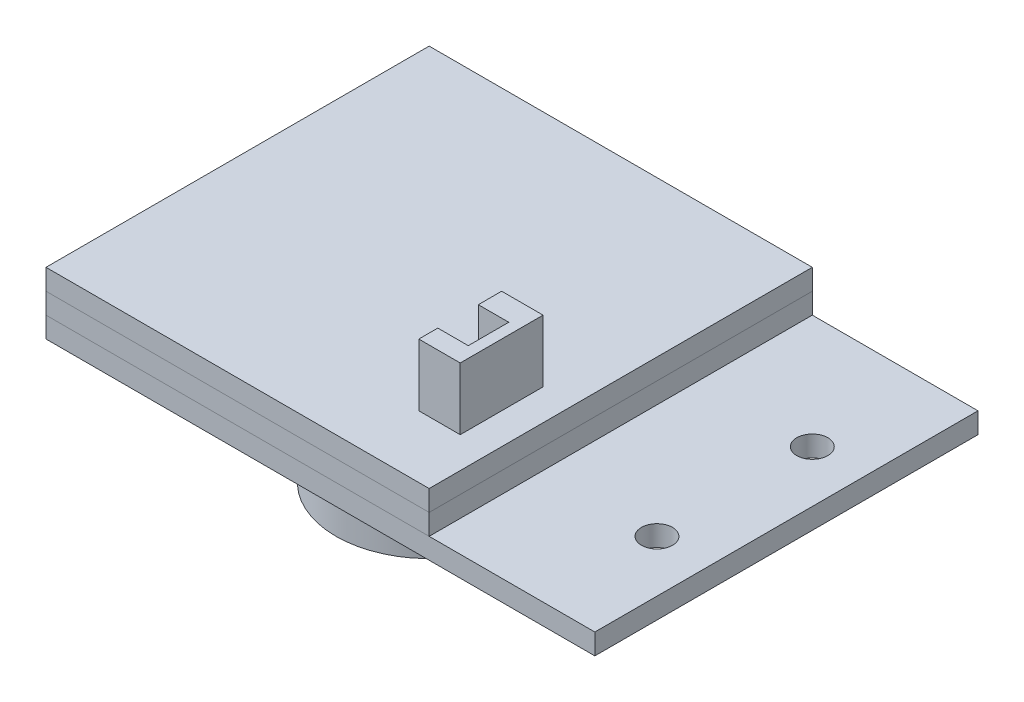
from build123d import *

# Parameters (mm, degrees)
SKETCH_1_W          = 53
SKETCH_1_H          = 37
SKETCH_1_R          = 1.5
EXTRUDE_1_DEPTH     = 2
SKETCH_2_W          = 37
SKETCH_2_H          = 37
EXTRUDE_2_DEPTH     = 2
SKETCH_3_W          = 37
SKETCH_3_H          = 37
EXTRUDE_3_DEPTH     = 2
EXTRUDE_4_DEPTH     = 6
SKETCH_5_R          = 1
EXTRUDE_5_DEPTH     = 4
SKETCH_6_R          = 9
EXTRUDE_6_DEPTH     = 8
SKETCH_7_R          = 6.62448747
CUT_EXTRUDE_1_DEPTH = 2


with BuildPart() as part:
    # 草图1 → 凸台-拉伸1 (new body)
    with BuildSketch(Plane(origin=(0, 0, 0), x_dir=(1, 0, 0), z_dir=(0, 1, 0))):
        Rectangle(SKETCH_1_W, SKETCH_1_H)
        with Locations((21.5, 7.5)):
            Circle(SKETCH_1_R, mode=Mode.SUBTRACT)
        with Locations((21.5, -7.5)):
            Circle(SKETCH_1_R, mode=Mode.SUBTRACT)
    extrude(amount=EXTRUDE_1_DEPTH)

    # 草图5 → 凸台-拉伸5 (add)
    with BuildSketch(Plane.XZ):
        with BuildLine():
            Line((-6, 11.5), (-6, 9.5))
            Line((-6, 9.5), (1.5, 9.5))
            Line((1.5, 9.5), (1.5, -9.5))
            Line((1.5, -9.5), (-6, -9.5))
            Line((-6, -9.5), (-6, -11.5))
            ThreePointArc((-6, -11.5), (-8, -13.5), (-10, -11.5))
            Line((-10, -11.5), (-10, -9.5))
            Line((-10, -9.5), (-17.5, -9.5))
            Line((-17.5, -9.5), (-17.5, 9.5))
            Line((-17.5, 9.5), (-10, 9.5))
            Line((-10, 9.5), (-10, 11.5))
            ThreePointArc((-10, 11.5), (-8, 13.5), (-6, 11.5))
        make_face()
        with Locations((-8, 11.5)):
            Circle(SKETCH_5_R, mode=Mode.SUBTRACT)
        with Locations((-8, -11.5)):
            Circle(SKETCH_5_R, mode=Mode.SUBTRACT)
    extrude(amount=EXTRUDE_5_DEPTH)

    # 草图6 → 凸台-拉伸6 (add)
    with BuildSketch(Plane.XZ.offset(4)):
        with Locations((-8, 0)):
            Circle(SKETCH_6_R)
    extrude(amount=EXTRUDE_6_DEPTH)

    # 草图7 → 切除-拉伸1 (cut)
    with BuildSketch(Plane.XZ.offset(12)):
        with Locations((-8, 0)):
            Circle(SKETCH_7_R)
    extrude(amount=-CUT_EXTRUDE_1_DEPTH, mode=Mode.SUBTRACT)

    # 草图8 → 旋转1 (revolve)
    with BuildSketch(Plane(origin=(-8, 0, 0), x_dir=(0, -1, 0), z_dir=(1, 0, 0))):
        with BuildLine():
            Line((10, 0), (11.720143423, 0))
            add(Edge.make_bspline(
                [(10, -6.62448747), (11.859849746, -3.586362146), (11.720143423, 0)],
                knots=[0, 0, 0, 1, 1, 1], degree=2))
            Line((10, -6.62448747), (10, 0))
        make_face()
    revolve(axis=Axis((-8, -10, 0), (0, -1, 0)))

    # 草图9 → 切除-旋转1 (revolve, cut)
    with BuildSketch(Plane(origin=(-8, 0, 0), x_dir=(0, -1, 0), z_dir=(1, 0, 0))):
        with BuildLine():
            Line((6, -9), (7.5, -9))
            Line((7.5, -9), (7.5, -8.423402625))
            ThreePointArc((7.5, -8.423402625), (7.353553391, -8.069849234), (7, -7.923402625))
            Line((7, -7.923402625), (6.5, -7.923402625))
            ThreePointArc((6.5, -7.923402625), (6.146446609, -8.069849234), (6, -8.423402625))
            Line((6, -8.423402625), (6, -9))
        make_face()
    revolve(axis=Axis((-8, -6.28732061, 0), (0, -1, 0)), mode=Mode.SUBTRACT)


with BuildPart() as body_2:
    # 草图2 → 凸台-拉伸2 (new body)
    with BuildSketch(Plane(origin=(0, 2, 0), x_dir=(1, 0, 0), z_dir=(0, 1, 0))):
        with Locations((-8, 0)):
            Rectangle(SKETCH_2_W, SKETCH_2_H)
    extrude(amount=EXTRUDE_2_DEPTH)


with BuildPart() as body_3:
    # 草图3 → 凸台-拉伸3 (new body)
    with BuildSketch(Plane(origin=(0, 4, 0), x_dir=(1, 0, 0), z_dir=(0, 1, 0))):
        with Locations((-8, 0)):
            Rectangle(SKETCH_3_W, SKETCH_3_H)
    extrude(amount=EXTRUDE_3_DEPTH)

    # 草图4 → 凸台-拉伸4 (add)
    with BuildSketch(Plane(origin=(0, 6, 0), x_dir=(1, 0, 0), z_dir=(0, 1, 0))):
        Polygon((3.5, -10.664911908), (3.5, -12.5), (7.5, -12.5), (7.5, -4.5), (3.5, -4.5), (3.5, -6.751845124), (6.441233058, -6.751845124), (6.441233058, -10.664911908), align=None)
    extrude(amount=EXTRUDE_4_DEPTH)


solid = Compound([part.part, body_2.part, body_3.part])
